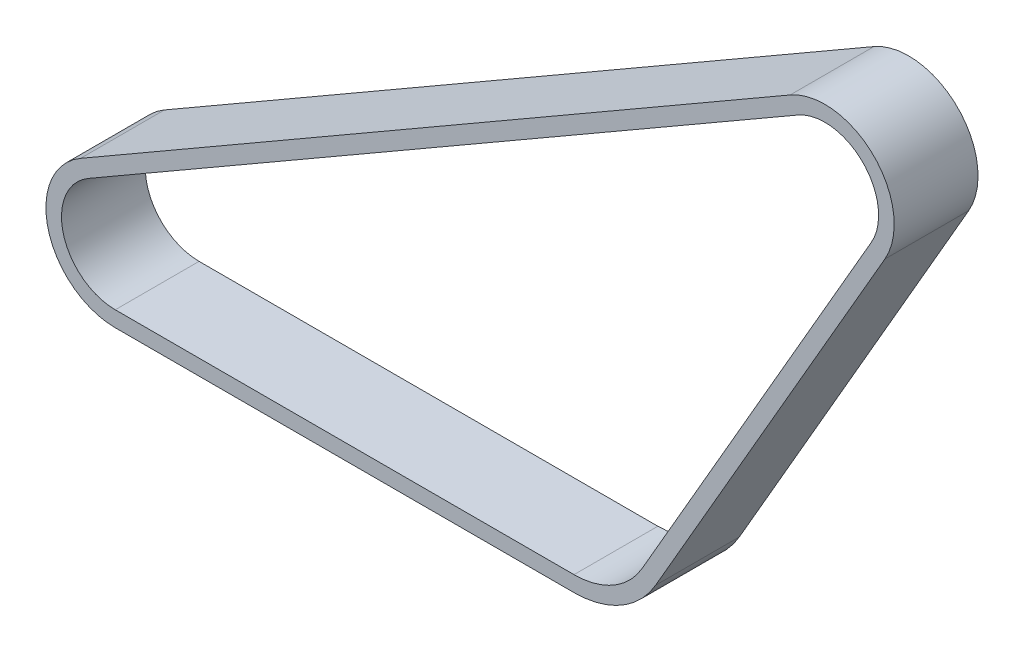
from build123d import *

# Parameters (mm, degrees)
BOSS_EXTRUDE1_DEPTH = 17.0815


with BuildPart() as part:
    # Sketch1 → Boss-Extrude1 (new body)
    with BuildSketch(Plane.XY):
        with BuildLine():
            Line((44.041805694, 90.661857966), (-100.536375, 7.189606424))
            ThreePointArc((-100.536375, 7.189606424), (-107.119324518, -8.703039583), (-93.472, -19.175))
            Line((-93.472, -19.175), (0, -19.175))
            ThreePointArc((0, -19.175), (9.5875, -16.606037118), (16.606037118, -9.5875))
            Line((16.606037118, -9.5875), (63.342037118, 71.361626543))
            ThreePointArc((63.342037118, 71.361626543), (61.096715629, 88.416536477), (44.041805694, 90.661857966))
        make_face()
        with BuildLine():
            Line((-93.472, -16), (0, -16))
            ThreePointArc((0, -16), (8, -13.856406461), (13.856406461, -8))
            Line((13.856406461, -8), (60.592406461, 72.949126543))
            ThreePointArc((60.592406461, 72.949126543), (58.851651598, 86.171472447), (45.629305694, 87.912227309))
            Line((45.629305694, 87.912227309), (-98.948875, 4.439975767))
            ThreePointArc((-98.948875, 4.439975767), (-104.05251002, -7.881289115), (-93.472, -16))
        make_face(mode=Mode.SUBTRACT)
    extrude(amount=BOSS_EXTRUDE1_DEPTH)


solid = part.part
